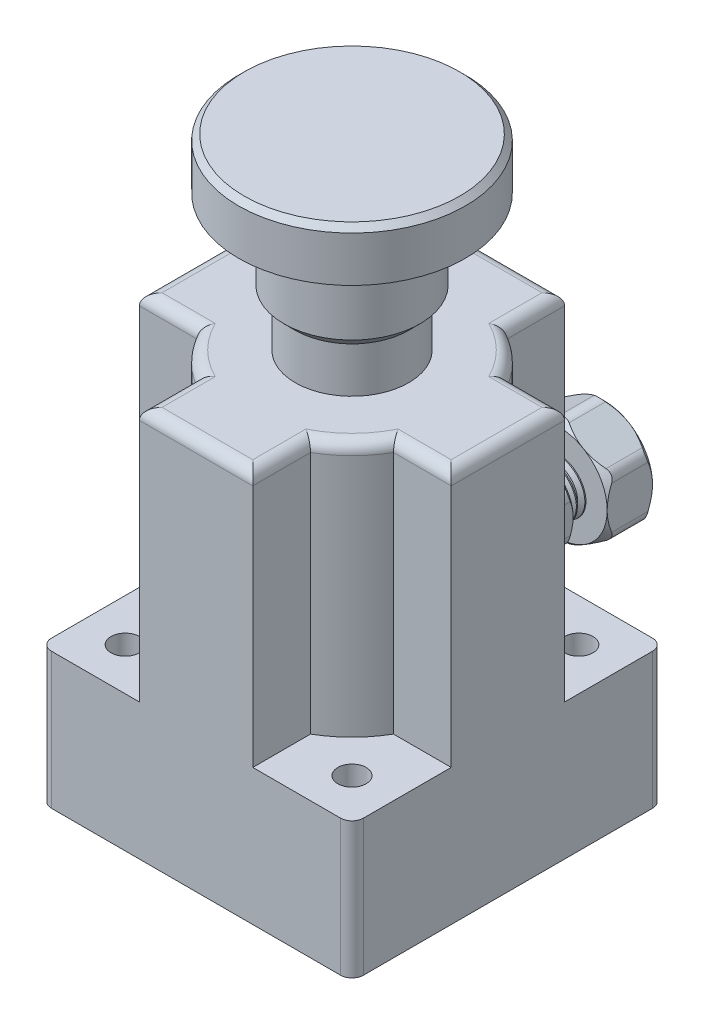
from build123d import *

# Parameters (mm, degrees)
SKETCH_1_W      = 55
SKETCH_1_H      = 55
SKETCH_1_R      = 2.5
SKETCH_1_R_2    = 2
EXTRUDE_1_DEPTH = 24
EXTRUDE_2_DEPTH = 45
EXTRUDE_3_DEPTH = 5
SKETCH_5_R      = 5
EXTRUDE_4_DEPTH = 12
THREAD_1_PITCH  = 1.5
EXTRUDE_5_DEPTH = 8
FILLET_1_R      = 2
FILLET_2_R      = 2
SKETCH_13_R     = 19
EXTRUDE_6_DEPTH = 1
SKETCH_14_R     = 1
EXTRUDE_7_DEPTH = 2
SKETCH_15_R     = 2
SKETCH_15_R_2   = 1
EXTRUDE_8_DEPTH = 2
SKETCH_16_R     = 1
EXTRUDE_9_DEPTH = 2
CHAMFER_1_SIZE  = 1


with BuildPart() as part:
    # Sketch 1 → 凸台-拉伸1 (new body)
    with BuildSketch(Plane(origin=(0, 0, 0), x_dir=(1, 0, 0), z_dir=(0, 1, 0))):
        Rectangle(SKETCH_1_W, SKETCH_1_H)
        with Locations(Location((-20, 20, 0), (0, 0, 270))):
            Circle(SKETCH_1_R, mode=Mode.SUBTRACT)
        with Locations(Location((20, 20, 0), (0, 0, 270))):
            Circle(SKETCH_1_R, mode=Mode.SUBTRACT)
        with Locations(Location((20, -20, 0), (0, 0, 270))):
            Circle(SKETCH_1_R, mode=Mode.SUBTRACT)
        with Locations(Location((-20, -20, 0), (0, 0, 270))):
            Circle(SKETCH_1_R, mode=Mode.SUBTRACT)
        with Locations(Location((0, 18, 0), (0, 0, 270))):
            Circle(SKETCH_1_R_2, mode=Mode.SUBTRACT)
        with Locations(Location((18, 0, 0), (0, 0, 270))):
            Circle(SKETCH_1_R_2, mode=Mode.SUBTRACT)
        with Locations(Location((0, -18, 0), (0, 0, 270))):
            Circle(SKETCH_1_R_2, mode=Mode.SUBTRACT)
        with Locations(Location((-18, 0, 0), (0, 0, 270))):
            Circle(SKETCH_1_R_2, mode=Mode.SUBTRACT)
    extrude(amount=EXTRUDE_1_DEPTH)

    # 草图2 → 凸台-拉伸2 (add)
    with BuildSketch(Plane(origin=(0, 24, 0), x_dir=(1, 0, 0), z_dir=(0, 1, 0))):
        with BuildLine():
            Line((-10, 27.5), (-10, 17.320508076))
            ThreePointArc((-10, 17.320508076), (-14.142135624, 14.142135624), (-17.320508076, 10))
            Line((-17.320508076, 10), (-27.5, 10))
            Line((-27.5, 10), (-27.5, -10))
            Line((-27.5, -10), (-17.320508076, -10))
            ThreePointArc((-17.320508076, -10), (-14.142135624, -14.142135624), (-10, -17.320508076))
            Line((-10, -17.320508076), (-10, -27.5))
            Line((-10, -27.5), (10, -27.5))
            Line((10, -27.5), (10, -17.320508076))
            ThreePointArc((10, -17.320508076), (14.142135624, -14.142135624), (17.320508076, -10))
            Line((17.320508076, -10), (27.5, -10))
            Line((27.5, -10), (27.5, 10))
            Line((27.5, 10), (17.320508076, 10))
            ThreePointArc((17.320508076, 10), (14.142135624, 14.142135624), (10, 17.320508076))
            Line((10, 17.320508076), (10, 27.5))
            Line((10, 27.5), (-10, 27.5))
        make_face()
    extrude(amount=EXTRUDE_2_DEPTH)

    # 草图3 → 旋转1 (revolve)
    with BuildSketch(Plane.XY, mode=Mode.PRIVATE) as revolve_1_sk:
        Polygon((-10, 69), (-10, 77), (-12, 79), (-12, 93), (-20, 93), (-20, 101), (-19, 102), (0, 102), (0, 69), align=None)
    revolve(revolve_1_sk.sketch.rotate(Axis((0, 121.360177633, 0), (0, -1, 0)), 270), axis=Axis((0, 121.360177633, 0), (0, -1, 0)))

    # 草图4 → 凸台-拉伸3 (add)
    with BuildSketch(Plane(origin=(0, 0, -27.5), x_dir=(-1, 0, 0), z_dir=(0, 0, -1))):
        Polygon((0, 38.005553499), (-6.5, 34.25277675), (-6.5, 26.74722325), (0, 22.994446501), (6.5, 26.74722325), (6.5, 34.25277675), align=None)
    extrude(amount=EXTRUDE_3_DEPTH)

    # 草图5 → 凸台-拉伸4 (add)
    with BuildSketch(Plane(origin=(0, 0, -32.5), x_dir=(-1, 0, 0), z_dir=(0, 0, -1))):
        with Locations((0, 30.5)):
            Circle(SKETCH_5_R)
    extrude(amount=EXTRUDE_4_DEPTH)

    # 螺纹线1: the profile of Sketch 1 2 profile screwed along a right-hand helix of 10 turns, 8 arcs to a turn; built about Z, then put on its axis
    thread_1_z = Axis((0, 0, 0), (0, 0, 1))
    thread_1_corners = [(5.0003, 0, -0.000173205), (5.0003, 0, 1.312673201), (4.188101188, 0, 0.843749998), (4.188101188, 0, 0.468749998)]
    with BuildLine(mode=Mode.PRIVATE) as thread_1_profile:
        Line(thread_1_corners[0], thread_1_corners[1])
        Line(thread_1_corners[1], thread_1_corners[2])
        Line(thread_1_corners[2], thread_1_corners[3])
        Line(thread_1_corners[3], thread_1_corners[0])
    thread_1_cap = Face(thread_1_profile.wire())
    thread_1_turn_angles = [0, 22.5, 45, 67.5, 90, 112.5, 135, 157.5, 180, 202.5, 225, 247.5, 270, 292.5, 315, 337.5, 360]
    thread_1_turn_weights = [1, 0.9238795325112867, 1, 0.9238795325112867, 1, 0.9238795325112867, 1, 0.9238795325112867, 1, 0.9238795325112867, 1, 0.9238795325112867, 1, 0.9238795325112867, 1, 0.9238795325112867, 1]
    thread_1_turn_rails = [Edge.make_bspline([Vector(p[0], p[1], 0).rotate(thread_1_z, thread_1_turn_angles[k]) / thread_1_turn_weights[k] + Vector(0, 0, p[2] + THREAD_1_PITCH * thread_1_turn_angles[k] / 360) for k in range(17)], [0, 0, 0, 1, 1, 2, 2, 3, 3, 4, 4, 5, 5, 6, 6, 7, 7, 8, 8, 8], 2, thread_1_turn_weights) for p in thread_1_corners]
    thread_1_turn_sides = [Face.make_surface_from_curves(thread_1_turn_rails[p[0]], thread_1_turn_rails[p[1]]) for p in [(0, 1), (1, 2), (2, 3), (3, 0)]]
    thread_1 = Plane(origin=(0, 30.5, -32.5), x_dir=(-1, 0, 0), z_dir=(0, 0, -1)) * Solid(Shell([*[p.moved(Location((0, 0, THREAD_1_PITCH * i))) for i in range(10) for p in thread_1_turn_sides], thread_1_cap, thread_1_cap.rotate(thread_1_z, 3600).moved(Location((0, 0, THREAD_1_PITCH * 3600 / 360)))]))
    add(thread_1, mode=Mode.SUBTRACT)

    # 草图9 → 凸台-拉伸5 (add)
    with BuildSketch(Plane(origin=(0, 0, -44.5), x_dir=(-1, 0, 0), z_dir=(0, 0, -1))):
        Polygon((0, 20.685045424), (8.5, 25.592522712), (8.5, 35.407477288), (0, 40.314954576), (-8.5, 35.407477288), (-8.5, 25.592522712), align=None)
    extrude(amount=-EXTRUDE_5_DEPTH)

    # 圆角1
    fillet_1_edges = [part.edges().sort_by_distance(p)[0] for p in [
        (-6.5, 34.25277675, -30),
        (0, 38.005553499, -30),
        (6.5, 34.25277675, -30),
        (6.5, 26.74722325, -30),
        (0, 22.994446501, -30),
        (-6.5, 26.74722325, -30),
        (0, 20.685045424, -40.5),
        (8.5, 25.592522712, -40.5),
        (8.5, 35.407477288, -40.5),
        (0, 40.314954576, -40.5),
        (-8.5, 35.407477288, -40.5),
        (-8.5, 25.592522712, -40.5),
    ]]
    fillet(fillet_1_edges, radius=FILLET_1_R)

    # 草图12 → 切除-旋转1 (revolve, cut)
    with BuildSketch(Plane(origin=(0, 0, 0), x_dir=(0, 0, -1), z_dir=(1, 0, 0))):
        Polygon((43.494446501, 40.005553499), (44.5, 39), (44.5, 40.005553499), align=None)
        Polygon((36.5, 40.005553499), (37.505553499, 40.005553499), (36.5, 39), align=None)
        Polygon((31.803847577, 37.696152423), (32.5, 37.696152423), (32.5, 37), align=None)
    revolve(axis=Axis((0, 30.5, 35.113983773), (0, 0, -1)), mode=Mode.SUBTRACT)

    # 圆角2
    fillet_2_edges = [part.edges().sort_by_distance(p)[0] for p in [
        (0, 69, -27.5),
        (-10, 69, -22.410254038),
        (-14.142135624, 69, -14.142135624),
        (-22.410254038, 69, -10),
        (-27.5, 69, 0),
        (-22.410254038, 69, 10),
        (-14.142135624, 69, 14.142135624),
        (-10, 69, 22.410254038),
        (0, 69, 27.5),
        (10, 69, 22.410254038),
        (14.142135624, 69, 14.142135624),
        (22.410254038, 69, 10),
        (27.5, 69, 0),
        (22.410254038, 69, -10),
        (14.142135624, 69, -14.142135624),
        (10, 69, -22.410254038),
        (27.5, 12, 27.5),
        (-27.5, 12, 27.5),
        (-27.5, 12, -27.5),
        (27.5, 12, -27.5),
        (0, 93, -12),
    ]]
    fillet(fillet_2_edges, radius=FILLET_2_R)


with BuildPart() as body_2:
    # 草图13 → 凸台-拉伸6 (new body)
    with BuildSketch(Plane.XZ.offset(-93.5)):
        with Locations(Location((0, 0, 0), (0, 0, 270))):
            Circle(SKETCH_13_R)
    extrude(amount=-EXTRUDE_6_DEPTH)

    # 草图14 → 凸台-拉伸7 (add)
    with BuildSketch(Plane(origin=(0, 94.5, 0), x_dir=(1, 0, 0), z_dir=(0, 1, 0))):
        with Locations(Location((0, 0, 0), (0, 0, 90))):
            Circle(SKETCH_14_R)
    extrude(amount=EXTRUDE_7_DEPTH)

    # 草图15 → 凸台-拉伸8 (add)
    # profile 1 of 3: a face of its own
    with BuildSketch(Plane(origin=(0, 96.5, 0), x_dir=(1, 0, 0), z_dir=(0, 1, 0))):
        with BuildLine():
            Line((7.851748786, 8.912408958), (0.780680974, 1.841341146))
            ThreePointArc((0.780680974, 1.841341146), (1.414213562, 1.414213562), (1.841341146, 0.780680974))
            Line((1.841341146, 0.780680974), (8.912408958, 7.851748786))
            Line((8.912408958, 7.851748786), (9.97306913, 6.791088614))
            Line((9.97306913, 6.791088614), (11.564059387, 11.564059387))
            Line((11.564059387, 11.564059387), (6.791088614, 9.97306913))
            Line((6.791088614, 9.97306913), (7.851748786, 8.912408958))
        make_face()
    # profile 2 of 3: a face of its own
    with BuildSketch(Plane(origin=(0, 96.5, 0), x_dir=(1, 0, 0), z_dir=(0, 1, 0))):
        Circle(SKETCH_15_R)
        with Locations(Location((0, 0, 0), (0, 0, 90))):
            Circle(SKETCH_15_R_2, mode=Mode.SUBTRACT)
    # profile 3 of 3: a face of its own
    with BuildSketch(Plane(origin=(0, 96.5, 0), x_dir=(1, 0, 0), z_dir=(0, 1, 0))):
        with Locations(Location((0, 0, 0), (0, 0, 90))):
            Circle(SKETCH_15_R_2)
    extrude(amount=EXTRUDE_8_DEPTH)

    # 草图16 → 凸台-拉伸9 (add)
    with BuildSketch(Plane(origin=(0, 98.5, 0), x_dir=(1, 0, 0), z_dir=(0, 1, 0))):
        with Locations(Location((0, 0, 0), (0, 0, 90))):
            Circle(SKETCH_16_R)
    extrude(amount=EXTRUDE_9_DEPTH)

    # 倒角1
    chamfer_1_edges = [body_2.edges().sort_by_distance(p)[0] for p in [
        (0, 100.5, 1),
    ]]
    chamfer(chamfer_1_edges, length=CHAMFER_1_SIZE)


solid = Compound([part.part, body_2.part])
